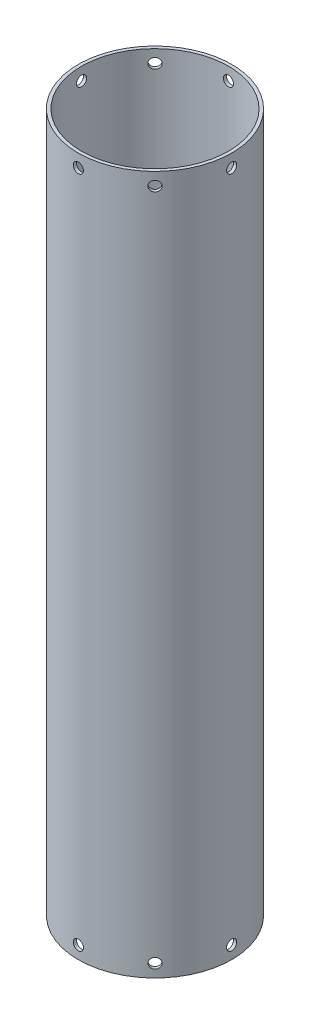
from build123d import *

# Parameters (mm, degrees)
SKETCH1_R                   = 76.2
SKETCH1_R_2                 = 73.025
BOSS_EXTRUDE1_DEPTH         = 693.1406
LOX_TOP_HOLES_REACH         = 678.38
LOX_TOP_HOLES_END_RADIUS    = 76.2
SKETCH2_R                   = 5.0165
CIRPATTERN1_COUNT           = 8
LOX_BOTTOM_HOLES_REACH      = 678.38
LOX_BOTTOM_HOLES_END_RADIUS = 76.2
SKETCH3_R                   = 5.0165
CIRPATTERN2_COUNT           = 8


with BuildPart() as part:
    # Sketch1 → Boss-Extrude1 (new body)
    with BuildSketch(Plane(origin=(0, 0, 0), x_dir=(1, 0, 0), z_dir=(0, 1, 0))):
        Circle(SKETCH1_R)
        Circle(SKETCH1_R_2, mode=Mode.SUBTRACT)
    extrude(amount=BOSS_EXTRUDE1_DEPTH)

    # LOX Top Holes: up to this cylinder (the profile starts inside it)
    lox_top_holes_end = Plane(origin=(0, 680.4406, 0), z_dir=(0, -1, 0)) * Cylinder(LOX_TOP_HOLES_END_RADIUS, 1510.16, mode=Mode.PRIVATE)
    # Sketch2 → LOX Top Holes (cut, up to the surface)
    with BuildSketch(Plane(origin=(0, 667.7406, 0), x_dir=(0, 0, 1), z_dir=(1, 0, 0)), mode=Mode.PRIVATE) as lox_top_holes_sk1:
        with Locations((0, -12.7)):
            Circle(SKETCH2_R)
    lox_top_holes_tool1 = extrude(lox_top_holes_sk1.sketch, amount=LOX_TOP_HOLES_REACH, mode=Mode.PRIVATE) & lox_top_holes_end
    lox_top_holes = lox_top_holes_tool1.solids().sort_by_distance((0, 680.4406, 0))[0]
    add(lox_top_holes, mode=Mode.SUBTRACT)

    # CirPattern1: LOX Top Holes ×8 about axis
    cirpattern1_axis = Axis((0, 693.1406, 0), (0, 1, 0))
    for i in range(1, CIRPATTERN1_COUNT):
        add(lox_top_holes.rotate(cirpattern1_axis, i * 360 / CIRPATTERN1_COUNT), mode=Mode.SUBTRACT)

    # LOX Bottom Holes: up to this cylinder (the profile starts inside it)
    lox_bottom_holes_end = Plane(origin=(0, 12.7, 0), z_dir=(0, -1, 0)) * Cylinder(LOX_BOTTOM_HOLES_END_RADIUS, 1510.16, mode=Mode.PRIVATE)
    # Sketch3 → LOX Bottom Holes (cut, up to the surface)
    with BuildSketch(Plane(origin=(0, 25.4, 0), x_dir=(0, 0, -1), z_dir=(1, 0, 0)), mode=Mode.PRIVATE) as lox_bottom_holes_sk1:
        with Locations((0, -12.7)):
            Circle(SKETCH3_R)
    lox_bottom_holes_tool1 = extrude(lox_bottom_holes_sk1.sketch, amount=LOX_BOTTOM_HOLES_REACH, mode=Mode.PRIVATE) & lox_bottom_holes_end
    lox_bottom_holes = lox_bottom_holes_tool1.solids().sort_by_distance((0, 12.7, 0))[0]
    add(lox_bottom_holes, mode=Mode.SUBTRACT)

    # CirPattern2: LOX Bottom Holes ×8 about axis
    cirpattern2_axis = Axis((0, 0, 0), (0, 1, 0))
    for i in range(1, CIRPATTERN2_COUNT):
        add(lox_bottom_holes.rotate(cirpattern2_axis, i * 360 / CIRPATTERN2_COUNT), mode=Mode.SUBTRACT)


solid = part.part
